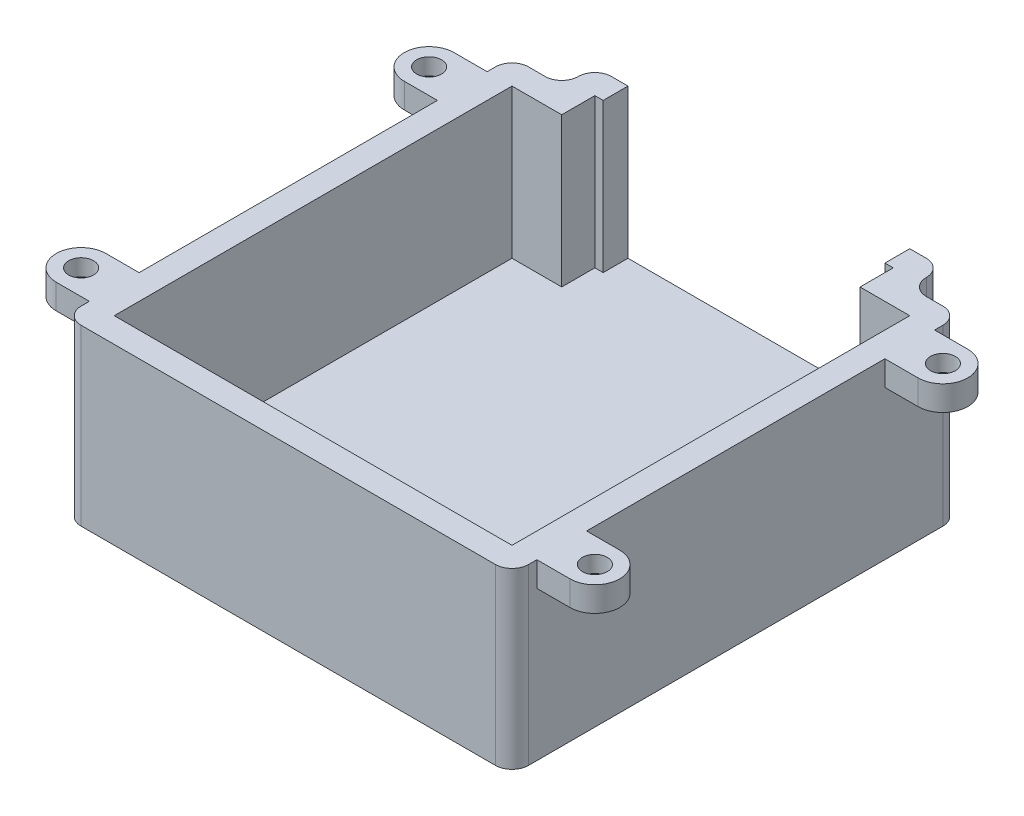
from build123d import *

# Parameters (mm, degrees)
BOSS_EXTRUDE1_DEPTH = 21
SHELL2_T            = -3
SKETCH2_W           = 34
SKETCH2_H           = 18
CUT_EXTRUDE1_DEPTH  = 3
FILLET2_R           = 2
SKETCH4_R           = 1.5
BOSS_EXTRUDE2_DEPTH = 3
CHAMFER1_SIZE       = 1


with BuildPart() as part:
    # Sketch1 → Boss-Extrude1 (new body)
    with BuildSketch(Plane(origin=(0, 0, 0), x_dir=(1, 0, 0), z_dir=(0, 1, 0))):
        Polygon((0, 54), (0, 0), (54, 0), (54, 54), (48, 54), (48, 58), (6, 58), (6, 54), align=None)
    extrude(amount=BOSS_EXTRUDE1_DEPTH)

    # Shell2
    shell2_openings = [part.faces().sort_by_distance(p)[0] for p in [
        (27, 21, -28.579766537),
    ]]
    offset(amount=SHELL2_T, openings=shell2_openings, kind=Kind.INTERSECTION)

    # Sketch2 → Cut-Extrude1 (cut)
    with BuildSketch(Plane(origin=(0, 0, -58), x_dir=(-1, 0, 0), z_dir=(0, 0, -1))):
        with Locations((-27, 12)):
            Rectangle(SKETCH2_W, SKETCH2_H)
    extrude(amount=-CUT_EXTRUDE1_DEPTH, mode=Mode.SUBTRACT)

    # Fillet2
    fillet2_edges = [part.edges().sort_by_distance(p)[0] for p in [
        (6, 10.5, -58),
        (6, 10.5, -54),
        (0, 10.5, -54),
        (0, 10.5, 0),
        (54, 10.5, 0),
        (48, 10.5, -54),
        (48, 10.5, -58),
        (54, 10.5, -54),
    ]]
    fillet(fillet2_edges, radius=FILLET2_R - 0.0001)  # a hair under: the kernel refuses the full size

    # Sketch4 → Boss-Extrude2 (add)
    # profile 1 of 4: a face of its own
    with BuildSketch(Plane(origin=(0, 21, 0), x_dir=(1, 0, 0), z_dir=(0, 1, 0))):
        with BuildLine():
            Line((0, 51), (0, 45))
            Line((0, 45), (-4, 45))
            ThreePointArc((-4, 45), (-7, 48), (-4, 51))
            Line((-4, 51), (0, 51))
        make_face()
        with Locations(Location((-4, 48, 0), (0, 0, 270))):
            Circle(SKETCH4_R, mode=Mode.SUBTRACT)
    # profile 2 of 4: a face of its own
    with BuildSketch(Plane(origin=(0, 21, 0), x_dir=(1, 0, 0), z_dir=(0, 1, 0))):
        with BuildLine():
            Line((-4, 3), (0, 3))
            Line((0, 3), (0, 9))
            Line((0, 9), (-4, 9))
            ThreePointArc((-4, 9), (-7, 6), (-4, 3))
        make_face()
        with Locations(Location((-4, 6, 0), (0, 0, 90))):
            Circle(SKETCH4_R, mode=Mode.SUBTRACT)
    # profile 3 of 4: a face of its own
    with BuildSketch(Plane(origin=(0, 21, 0), x_dir=(1, 0, 0), z_dir=(0, 1, 0))):
        with BuildLine():
            Line((58, 9), (54, 9))
            Line((54, 9), (54, 3))
            Line((54, 3), (58, 3))
            ThreePointArc((58, 3), (61, 6), (58, 9))
        make_face()
        with Locations(Location((58, 6, 0), (0, 0, 270))):
            Circle(SKETCH4_R, mode=Mode.SUBTRACT)
    # profile 4 of 4: a face of its own
    with BuildSketch(Plane(origin=(0, 21, 0), x_dir=(1, 0, 0), z_dir=(0, 1, 0))):
        with BuildLine():
            Line((58, 51), (54, 51))
            Line((54, 51), (54, 45))
            Line((54, 45), (58, 45))
            ThreePointArc((58, 45), (61, 48), (58, 51))
        make_face()
        with Locations(Location((58, 48, 0), (0, 0, 90))):
            Circle(SKETCH4_R, mode=Mode.SUBTRACT)
    extrude(amount=-BOSS_EXTRUDE2_DEPTH)

    # Chamfer1
    chamfer1_edges = [part.edges().sort_by_distance(p)[0] for p in [
        (-4, 18, -49.5),
        (-4, 18, -4.5),
        (58, 18, -7.5),
        (58, 18, -46.5),
    ]]
    chamfer(chamfer1_edges, length=CHAMFER1_SIZE)


solid = part.part
